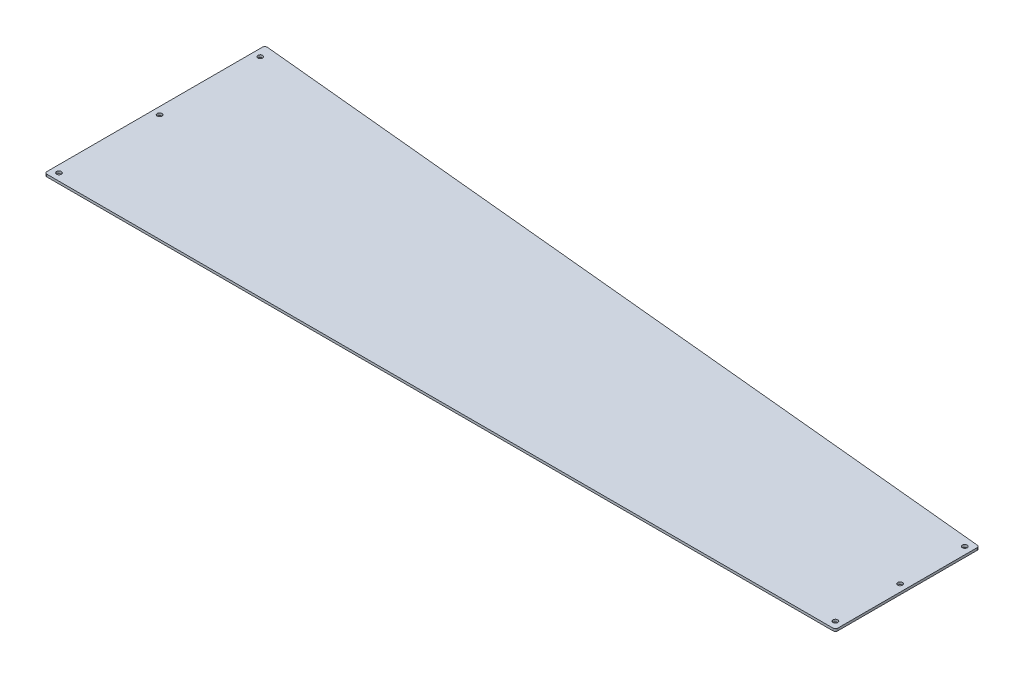
from build123d import *

# Parameters (mm, degrees)
BOSS_EXTRUDE1_DEPTH         = 3.175
FILLET1_R                   = 3.175
F_1_4_0_25_DIAMETER_HOLE1_D = 6.35


with BuildPart() as part:
    # Sketch1 → Boss-Extrude1 (new body)
    with BuildSketch(Plane(origin=(0, 0, 0), x_dir=(1, 0, 0), z_dir=(0, 1, 0))):
        Polygon((-634.164473684, 176.797368421), (413.585526316, 75.197368421), (413.585526316, -115.302631579), (-634.164473684, -115.302631579), align=None)
    extrude(amount=BOSS_EXTRUDE1_DEPTH)

    # Fillet1
    fillet1_edges = [part.edges().sort_by_distance(p)[0] for p in [
        (413.585526316, 1.5875, 115.302631579),
        (413.585526316, 1.5875, -75.197368421),
        (-634.164473684, 1.5875, 115.302631579),
        (-634.164473684, 1.5875, -176.797368421),
    ]]
    fillet(fillet1_edges, radius=FILLET1_R)

    # 1/4 (0.25) Diameter Hole1 (through all)
    with Locations(Plane(origin=(0, 3.175, 0), x_dir=(1, 0, 0), z_dir=(0, 1, 0))):
        with Locations((404.060526316, 65.672368421), (404.060526316, -20.052631579), (404.060526316, -105.777631579), (-624.639473684, -105.777631579), (-624.639473684, 27.572368421), (-624.639473684, 160.922368421)):
            Hole(F_1_4_0_25_DIAMETER_HOLE1_D / 2)


solid = part.part
